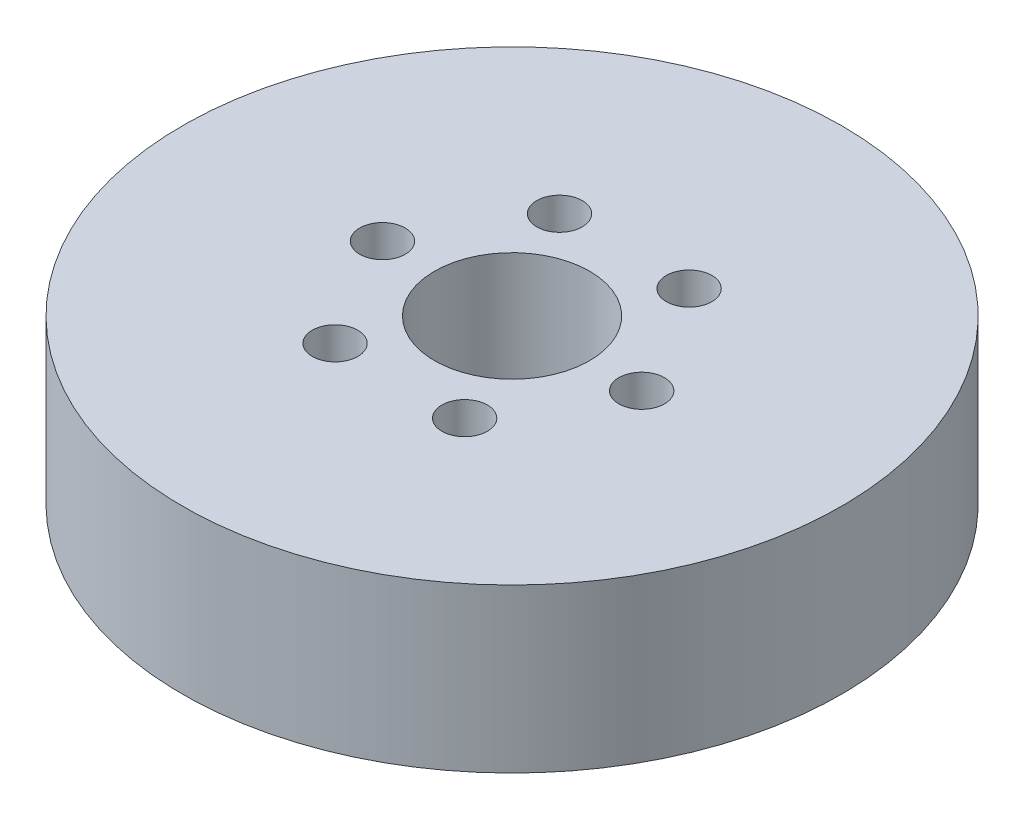
from build123d import *

# Parameters (mm, degrees)
SKETCH1_R           = 42.5
BOSS_EXTRUDE1_DEPTH = 21
SKETCH2_R           = 10
CUT_EXTRUDE1_DEPTH  = 64.667102965
SKETCH3_R           = 2.936770542
CUT_EXTRUDE2_DEPTH  = 19.651826989
CIRPATTERN1_COUNT   = 6


with BuildPart() as part:
    # Sketch1 → Boss-Extrude1 (new body)
    with BuildSketch(Plane(origin=(0, 0, 0), x_dir=(1, 0, 0), z_dir=(0, 1, 0))):
        Circle(SKETCH1_R)
    extrude(amount=BOSS_EXTRUDE1_DEPTH)

    # Sketch2 → Cut-Extrude1 (cut, through all)
    with BuildSketch(Plane(origin=(0, 0, 0), x_dir=(1, 0, 0), z_dir=(0, 1, 0))):
        Circle(SKETCH2_R)
    extrude(amount=CUT_EXTRUDE1_DEPTH, mode=Mode.SUBTRACT)

    # Sketch3 → Cut-Extrude2 (cut)
    with BuildSketch(Plane(origin=(0, 21, 0), x_dir=(1, 0, 0), z_dir=(0, 1, 0))):
        with Locations((-16.71126544, 0)):
            Circle(SKETCH3_R)
    cut_extrude2 = extrude(amount=-CUT_EXTRUDE2_DEPTH, mode=Mode.SUBTRACT)

    # CirPattern1: Cut-Extrude2 ×6 about axis
    cirpattern1_axis = Axis((0, 0, 0), (0, 1, 0))
    for i in range(1, CIRPATTERN1_COUNT):
        add(cut_extrude2.rotate(cirpattern1_axis, i * 360 / CIRPATTERN1_COUNT), mode=Mode.SUBTRACT)


solid = part.part
